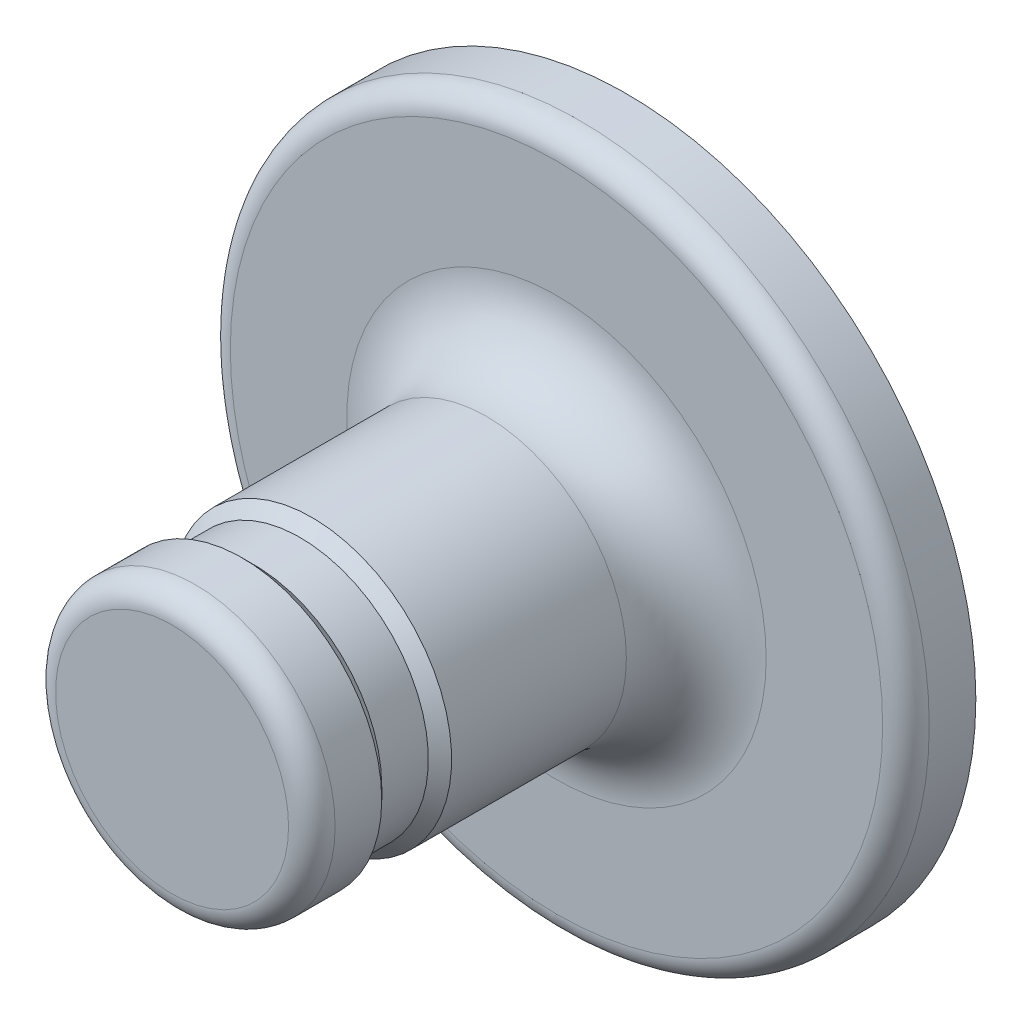
from build123d import *

# Parameters (mm, degrees)
SKETCH_1_R          = 15
EXTRUDE_1_DEPTH     = 3
SKETCH_2_R          = 6
EXTRUDE_2_DEPTH     = 16.5
FILLET_1_R          = 3
FILLET_2_R          = 1
FILLET_3_R          = 1
SKETCH_3_R          = 6
SKETCH_3_R_2        = 5.5
CUT_EXTRUDE_1_DEPTH = 4
CHAMFER_1_SIZE      = 1


with BuildPart() as part:
    # 草图1 → 凸台-拉伸1 (new body)
    with BuildSketch(Plane.XY):
        Circle(SKETCH_1_R)
    extrude(amount=EXTRUDE_1_DEPTH)

    # 草图2 → 凸台-拉伸2 (add)
    with BuildSketch(Plane.XY.offset(3)):
        Circle(SKETCH_2_R)
    extrude(amount=EXTRUDE_2_DEPTH)

    # 圆角1
    fillet_1_edges = [part.edges().sort_by_distance(p)[0] for p in [
        (-6, 0, 3),
    ]]
    fillet(fillet_1_edges, radius=FILLET_1_R)

    # 圆角2
    fillet_2_edges = [part.edges().sort_by_distance(p)[0] for p in [
        (-15, 0, 3),
    ]]
    fillet(fillet_2_edges, radius=FILLET_2_R)

    # 圆角3
    fillet_3_edges = [part.edges().sort_by_distance(p)[0] for p in [
        (-6, 0, 19.5),
    ]]
    fillet(fillet_3_edges, radius=FILLET_3_R)

    # 草图3 → 切除-拉伸1 (cut)
    with BuildSketch(Plane(origin=(0, 0, 13), x_dir=(-1, 0, 0), z_dir=(0, 0, -1))):
        Circle(SKETCH_3_R)
        Circle(SKETCH_3_R_2, mode=Mode.SUBTRACT)
    extrude(amount=-CUT_EXTRUDE_1_DEPTH, mode=Mode.SUBTRACT)

    # 倒角1
    # the kernel refuses this chamfer: 1 mm, written as the material it adds along each edge
    with BuildSketch(Plane(origin=(0, 0, 13), x_dir=(-1, 0, 0), z_dir=(0, -1, 0))) as chamfer_1_piece_1_section:
        Polygon((5.5 + CHAMFER_1_SIZE, 0), (5.5, -CHAMFER_1_SIZE), (5.5, 0), align=None)
    chamfer_1_piece_1 = revolve(axis=Axis((0, 0, 13), (0, 0, -1)), mode=Mode.PRIVATE)
    chamfer_1_piece_1 = chamfer_1_piece_1 & Plane(origin=(0, 0, 13.746832488), x_dir=(1, 0, 0), z_dir=(0, 0, -1)) * Cylinder(6, 26, mode=Mode.PRIVATE)
    add(chamfer_1_piece_1)
    with BuildSketch(Plane(origin=(0, 0, 17), x_dir=(-1, 0, 0), z_dir=(0, -1, 0))) as chamfer_1_piece_2_section:
        Polygon((5.5, CHAMFER_1_SIZE), (5.5 + CHAMFER_1_SIZE, 0), (5.5, 0), align=None)
    chamfer_1_piece_2 = revolve(axis=Axis((0, 0, 17), (0, 0, -1)), mode=Mode.PRIVATE)
    chamfer_1_piece_2 = chamfer_1_piece_2 & Plane(origin=(0, 0, 16.253167512), x_dir=(1, 0, 0), z_dir=(0, 0, -1)) * Cylinder(6, 26, mode=Mode.PRIVATE)
    add(chamfer_1_piece_2)


solid = part.part
